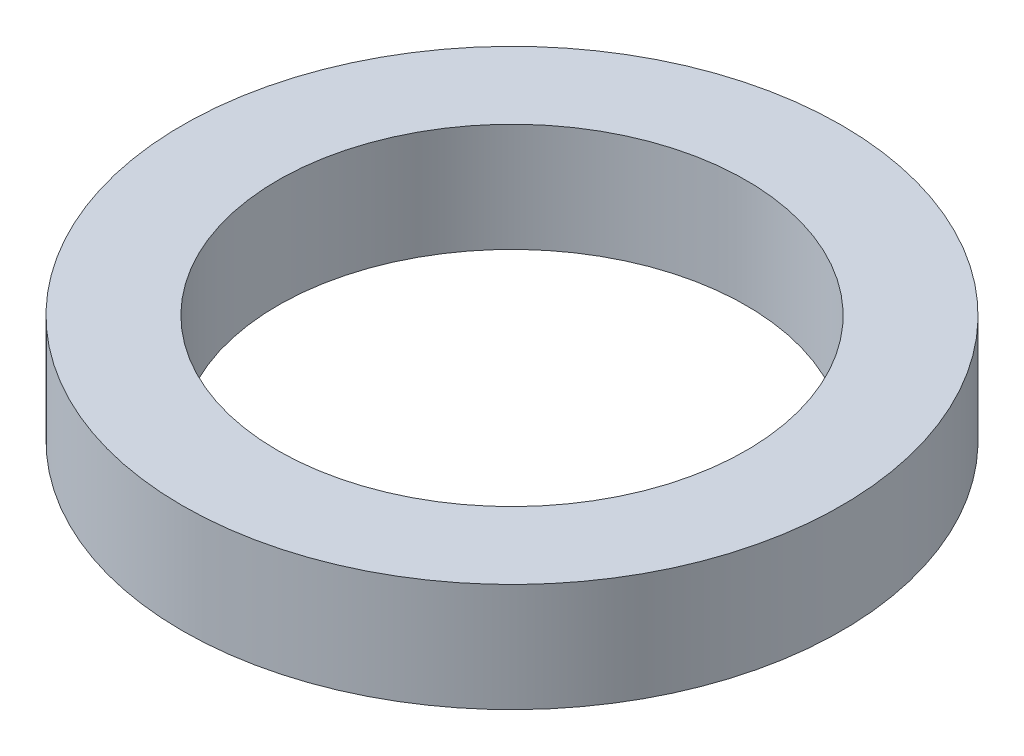
from build123d import *

# Parameters (mm, degrees)
SKETCH1_R           = 4.826
SKETCH1_R_2         = 3.429
BOSS_EXTRUDE1_DEPTH = 1.5875


with BuildPart() as part:
    # Sketch1 → Boss-Extrude1 (new body)
    with BuildSketch(Plane(origin=(0, 0, 0), x_dir=(1, 0, 0), z_dir=(0, 1, 0))):
        Circle(SKETCH1_R)
        Circle(SKETCH1_R_2, mode=Mode.SUBTRACT)
    extrude(amount=BOSS_EXTRUDE1_DEPTH)


solid = part.part
